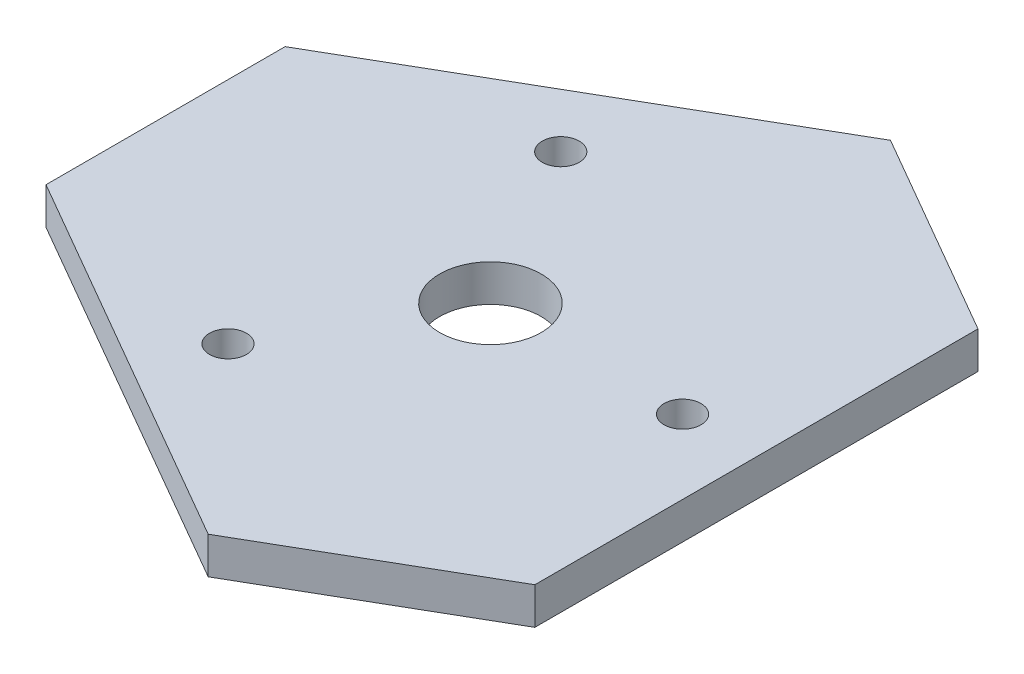
from build123d import *

# Parameters (mm, degrees)
SKETCH2_R           = 1.5875
SKETCH2_R_2         = 4.365625
BOSS_EXTRUDE2_DEPTH = 3.175


with BuildPart() as part:
    # Sketch2 → Boss-Extrude2 (new body)
    with BuildSketch(Plane(origin=(0, 0, 0), x_dir=(1, 0, 0), z_dir=(0, 1, 0))):
        Polygon((22.868144039, 19.05), (22.868144039, -19.05), (5.063711923, -29.329393675), (-27.931855961, -10.279393675), (-27.931855961, 10.279393675), (5.063711923, 29.329393675), align=None)
        with Locations((16.518144039, 0)):
            Circle(SKETCH2_R, mode=Mode.SUBTRACT)
        with Locations((-8.259072019, -14.305132361)):
            Circle(SKETCH2_R, mode=Mode.SUBTRACT)
        with Locations((-8.259072019, 14.305132361)):
            Circle(SKETCH2_R, mode=Mode.SUBTRACT)
        Circle(SKETCH2_R_2, mode=Mode.SUBTRACT)
    extrude(amount=BOSS_EXTRUDE2_DEPTH)


solid = part.part
